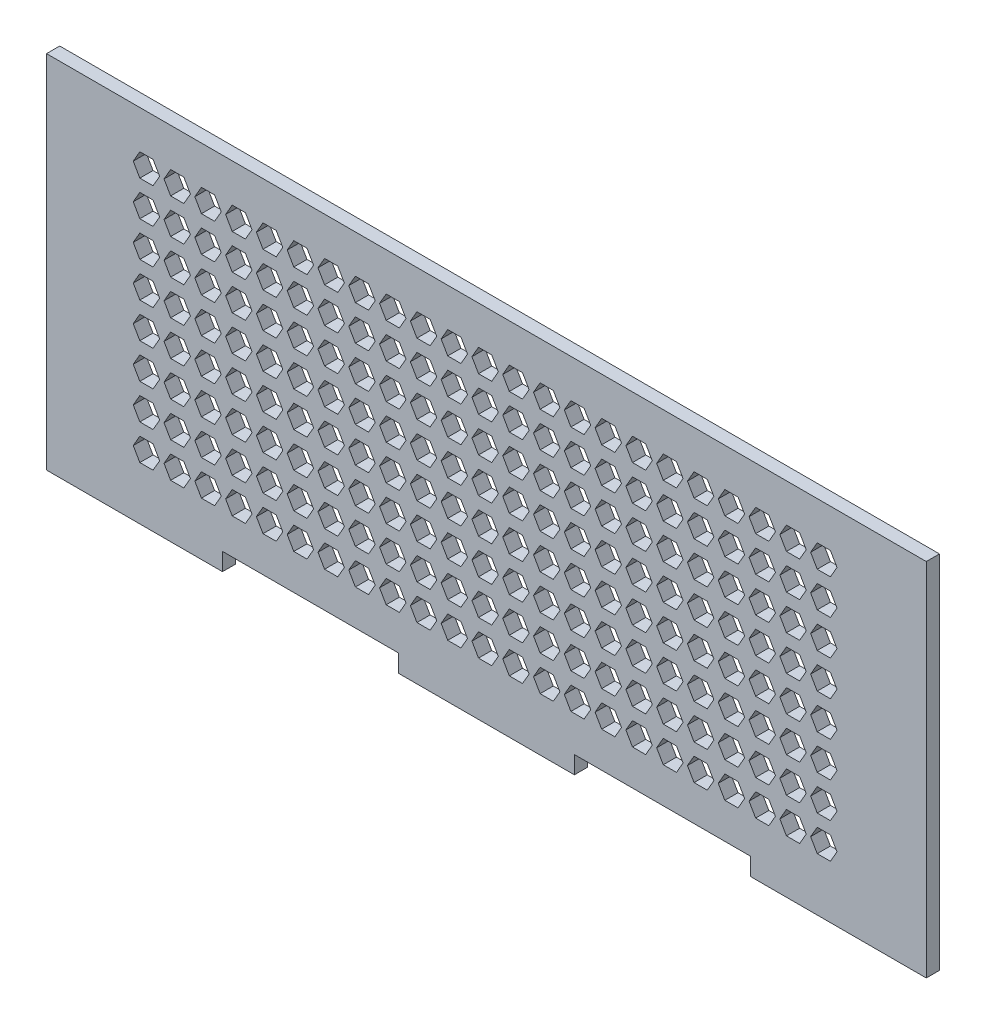
from build123d import *

# Parameters (mm, degrees)
BOSS_EXTRUDE1_DEPTH = 3


with BuildPart() as part:
    # Sketch1 → Boss-Extrude1 (new body)
    with BuildSketch(Plane.XY):
        Polygon((-20, -38), (-20, -42), (20, -42), (20, -38), (60, -38), (60, -42), (100, -42), (100, 40), (-100, 40), (-100, -42), (-60, -42), (-60, -38), align=None)
        Polygon((-78.790355831, -29.911633424), (-80.290355831, -27.313557212), (-78.790355831, -24.715481001), (-75.790355831, -24.715481001), (-74.290355831, -27.313557212), (-75.790355831, -29.911633424), align=None, mode=Mode.SUBTRACT)
        Polygon((-71.790355831, -24.715481001), (-68.790355831, -24.715481001), (-67.290355831, -27.313557212), (-68.790355831, -29.911633424), (-71.790355831, -29.911633424), (-73.290355831, -27.313557212), align=None, mode=Mode.SUBTRACT)
        Polygon((-64.790355831, -24.715481001), (-61.790355831, -24.715481001), (-60.290355831, -27.313557212), (-61.790355831, -29.911633424), (-64.790355831, -29.911633424), (-66.290355831, -27.313557212), align=None, mode=Mode.SUBTRACT)
        Polygon((-57.790355831, -24.715481001), (-54.790355831, -24.715481001), (-53.290355831, -27.313557212), (-54.790355831, -29.911633424), (-57.790355831, -29.911633424), (-59.290355831, -27.313557212), align=None, mode=Mode.SUBTRACT)
        Polygon((-50.790355831, -24.715481001), (-47.790355831, -24.715481001), (-46.290355831, -27.313557212), (-47.790355831, -29.911633424), (-50.790355831, -29.911633424), (-52.290355831, -27.313557212), align=None, mode=Mode.SUBTRACT)
        Polygon((-43.790355831, -24.715481001), (-40.790355831, -24.715481001), (-39.290355831, -27.313557212), (-40.790355831, -29.911633424), (-43.790355831, -29.911633424), (-45.290355831, -27.313557212), align=None, mode=Mode.SUBTRACT)
        Polygon((-36.790355831, -24.715481001), (-33.790355831, -24.715481001), (-32.290355831, -27.313557212), (-33.790355831, -29.911633424), (-36.790355831, -29.911633424), (-38.290355831, -27.313557212), align=None, mode=Mode.SUBTRACT)
        Polygon((-29.790355831, -24.715481001), (-26.790355831, -24.715481001), (-25.290355831, -27.313557212), (-26.790355831, -29.911633424), (-29.790355831, -29.911633424), (-31.290355831, -27.313557212), align=None, mode=Mode.SUBTRACT)
        Polygon((-22.790355831, -24.715481001), (-19.790355831, -24.715481001), (-18.290355831, -27.313557212), (-19.790355831, -29.911633424), (-22.790355831, -29.911633424), (-24.290355831, -27.313557212), align=None, mode=Mode.SUBTRACT)
        Polygon((-15.790355831, -24.715481001), (-12.790355831, -24.715481001), (-11.290355831, -27.313557212), (-12.790355831, -29.911633424), (-15.790355831, -29.911633424), (-17.290355831, -27.313557212), align=None, mode=Mode.SUBTRACT)
        Polygon((-8.790355831, -24.715481001), (-5.790355831, -24.715481001), (-4.290355831, -27.313557212), (-5.790355831, -29.911633424), (-8.790355831, -29.911633424), (-10.290355831, -27.313557212), align=None, mode=Mode.SUBTRACT)
        Polygon((-1.790355831, -24.715481001), (1.209644169, -24.715481001), (2.709644169, -27.313557212), (1.209644169, -29.911633424), (-1.790355831, -29.911633424), (-3.290355831, -27.313557212), align=None, mode=Mode.SUBTRACT)
        Polygon((-78.790355831, -16.715481001), (-75.790355831, -16.715481001), (-74.290355831, -19.313557212), (-75.790355831, -21.911633424), (-78.790355831, -21.911633424), (-80.290355831, -19.313557212), align=None, mode=Mode.SUBTRACT)
        Polygon((-78.790355831, -8.715481001), (-75.790355831, -8.715481001), (-74.290355831, -11.313557212), (-75.790355831, -13.911633424), (-78.790355831, -13.911633424), (-80.290355831, -11.313557212), align=None, mode=Mode.SUBTRACT)
        Polygon((-71.790355831, -16.715481001), (-68.790355831, -16.715481001), (-67.290355831, -19.313557212), (-68.790355831, -21.911633424), (-71.790355831, -21.911633424), (-73.290355831, -19.313557212), align=None, mode=Mode.SUBTRACT)
        Polygon((-64.790355831, -16.715481001), (-61.790355831, -16.715481001), (-60.290355831, -19.313557212), (-61.790355831, -21.911633424), (-64.790355831, -21.911633424), (-66.290355831, -19.313557212), align=None, mode=Mode.SUBTRACT)
        Polygon((-57.790355831, -16.715481001), (-54.790355831, -16.715481001), (-53.290355831, -19.313557212), (-54.790355831, -21.911633424), (-57.790355831, -21.911633424), (-59.290355831, -19.313557212), align=None, mode=Mode.SUBTRACT)
        Polygon((-71.790355831, -8.715481001), (-68.790355831, -8.715481001), (-67.290355831, -11.313557212), (-68.790355831, -13.911633424), (-71.790355831, -13.911633424), (-73.290355831, -11.313557212), align=None, mode=Mode.SUBTRACT)
        Polygon((-64.790355831, -8.715481001), (-61.790355831, -8.715481001), (-60.290355831, -11.313557212), (-61.790355831, -13.911633424), (-64.790355831, -13.911633424), (-66.290355831, -11.313557212), align=None, mode=Mode.SUBTRACT)
        Polygon((-57.790355831, -8.715481001), (-54.790355831, -8.715481001), (-53.290355831, -11.313557212), (-54.790355831, -13.911633424), (-57.790355831, -13.911633424), (-59.290355831, -11.313557212), align=None, mode=Mode.SUBTRACT)
        Polygon((-78.790355831, -0.715481001), (-75.790355831, -0.715481001), (-74.290355831, -3.313557212), (-75.790355831, -5.911633424), (-78.790355831, -5.911633424), (-80.290355831, -3.313557212), align=None, mode=Mode.SUBTRACT)
        Polygon((-71.790355831, -0.715481001), (-68.790355831, -0.715481001), (-67.290355831, -3.313557212), (-68.790355831, -5.911633424), (-71.790355831, -5.911633424), (-73.290355831, -3.313557212), align=None, mode=Mode.SUBTRACT)
        Polygon((-64.790355831, -0.715481001), (-61.790355831, -0.715481001), (-60.290355831, -3.313557212), (-61.790355831, -5.911633424), (-64.790355831, -5.911633424), (-66.290355831, -3.313557212), align=None, mode=Mode.SUBTRACT)
        Polygon((-57.790355831, -0.715481001), (-54.790355831, -0.715481001), (-53.290355831, -3.313557212), (-54.790355831, -5.911633424), (-57.790355831, -5.911633424), (-59.290355831, -3.313557212), align=None, mode=Mode.SUBTRACT)
        Polygon((-50.790355831, -16.715481001), (-47.790355831, -16.715481001), (-46.290355831, -19.313557212), (-47.790355831, -21.911633424), (-50.790355831, -21.911633424), (-52.290355831, -19.313557212), align=None, mode=Mode.SUBTRACT)
        Polygon((-43.790355831, -16.715481001), (-40.790355831, -16.715481001), (-39.290355831, -19.313557212), (-40.790355831, -21.911633424), (-43.790355831, -21.911633424), (-45.290355831, -19.313557212), align=None, mode=Mode.SUBTRACT)
        Polygon((-36.790355831, -16.715481001), (-33.790355831, -16.715481001), (-32.290355831, -19.313557212), (-33.790355831, -21.911633424), (-36.790355831, -21.911633424), (-38.290355831, -19.313557212), align=None, mode=Mode.SUBTRACT)
        Polygon((-29.790355831, -16.715481001), (-26.790355831, -16.715481001), (-25.290355831, -19.313557212), (-26.790355831, -21.911633424), (-29.790355831, -21.911633424), (-31.290355831, -19.313557212), align=None, mode=Mode.SUBTRACT)
        Polygon((-50.790355831, -8.715481001), (-47.790355831, -8.715481001), (-46.290355831, -11.313557212), (-47.790355831, -13.911633424), (-50.790355831, -13.911633424), (-52.290355831, -11.313557212), align=None, mode=Mode.SUBTRACT)
        Polygon((-43.790355831, -8.715481001), (-40.790355831, -8.715481001), (-39.290355831, -11.313557212), (-40.790355831, -13.911633424), (-43.790355831, -13.911633424), (-45.290355831, -11.313557212), align=None, mode=Mode.SUBTRACT)
        Polygon((-36.790355831, -8.715481001), (-33.790355831, -8.715481001), (-32.290355831, -11.313557212), (-33.790355831, -13.911633424), (-36.790355831, -13.911633424), (-38.290355831, -11.313557212), align=None, mode=Mode.SUBTRACT)
        Polygon((-29.790355831, -8.715481001), (-26.790355831, -8.715481001), (-25.290355831, -11.313557212), (-26.790355831, -13.911633424), (-29.790355831, -13.911633424), (-31.290355831, -11.313557212), align=None, mode=Mode.SUBTRACT)
        Polygon((-22.790355831, -16.715481001), (-19.790355831, -16.715481001), (-18.290355831, -19.313557212), (-19.790355831, -21.911633424), (-22.790355831, -21.911633424), (-24.290355831, -19.313557212), align=None, mode=Mode.SUBTRACT)
        Polygon((-15.790355831, -16.715481001), (-12.790355831, -16.715481001), (-11.290355831, -19.313557212), (-12.790355831, -21.911633424), (-15.790355831, -21.911633424), (-17.290355831, -19.313557212), align=None, mode=Mode.SUBTRACT)
        Polygon((-8.790355831, -16.715481001), (-5.790355831, -16.715481001), (-4.290355831, -19.313557212), (-5.790355831, -21.911633424), (-8.790355831, -21.911633424), (-10.290355831, -19.313557212), align=None, mode=Mode.SUBTRACT)
        Polygon((-1.790355831, -16.715481001), (1.209644169, -16.715481001), (2.709644169, -19.313557212), (1.209644169, -21.911633424), (-1.790355831, -21.911633424), (-3.290355831, -19.313557212), align=None, mode=Mode.SUBTRACT)
        Polygon((-22.790355831, -8.715481001), (-19.790355831, -8.715481001), (-18.290355831, -11.313557212), (-19.790355831, -13.911633424), (-22.790355831, -13.911633424), (-24.290355831, -11.313557212), align=None, mode=Mode.SUBTRACT)
        Polygon((-15.790355831, -8.715481001), (-12.790355831, -8.715481001), (-11.290355831, -11.313557212), (-12.790355831, -13.911633424), (-15.790355831, -13.911633424), (-17.290355831, -11.313557212), align=None, mode=Mode.SUBTRACT)
        Polygon((-8.790355831, -8.715481001), (-5.790355831, -8.715481001), (-4.290355831, -11.313557212), (-5.790355831, -13.911633424), (-8.790355831, -13.911633424), (-10.290355831, -11.313557212), align=None, mode=Mode.SUBTRACT)
        Polygon((-1.790355831, -8.715481001), (1.209644169, -8.715481001), (2.709644169, -11.313557212), (1.209644169, -13.911633424), (-1.790355831, -13.911633424), (-3.290355831, -11.313557212), align=None, mode=Mode.SUBTRACT)
        Polygon((-50.790355831, -0.715481001), (-47.790355831, -0.715481001), (-46.290355831, -3.313557212), (-47.790355831, -5.911633424), (-50.790355831, -5.911633424), (-52.290355831, -3.313557212), align=None, mode=Mode.SUBTRACT)
        Polygon((-43.790355831, -0.715481001), (-40.790355831, -0.715481001), (-39.290355831, -3.313557212), (-40.790355831, -5.911633424), (-43.790355831, -5.911633424), (-45.290355831, -3.313557212), align=None, mode=Mode.SUBTRACT)
        Polygon((-36.790355831, -0.715481001), (-33.790355831, -0.715481001), (-32.290355831, -3.313557212), (-33.790355831, -5.911633424), (-36.790355831, -5.911633424), (-38.290355831, -3.313557212), align=None, mode=Mode.SUBTRACT)
        Polygon((-29.790355831, -0.715481001), (-26.790355831, -0.715481001), (-25.290355831, -3.313557212), (-26.790355831, -5.911633424), (-29.790355831, -5.911633424), (-31.290355831, -3.313557212), align=None, mode=Mode.SUBTRACT)
        Polygon((-22.790355831, -0.715481001), (-19.790355831, -0.715481001), (-18.290355831, -3.313557212), (-19.790355831, -5.911633424), (-22.790355831, -5.911633424), (-24.290355831, -3.313557212), align=None, mode=Mode.SUBTRACT)
        Polygon((-15.790355831, -0.715481001), (-12.790355831, -0.715481001), (-11.290355831, -3.313557212), (-12.790355831, -5.911633424), (-15.790355831, -5.911633424), (-17.290355831, -3.313557212), align=None, mode=Mode.SUBTRACT)
        Polygon((-8.790355831, -0.715481001), (-5.790355831, -0.715481001), (-4.290355831, -3.313557212), (-5.790355831, -5.911633424), (-8.790355831, -5.911633424), (-10.290355831, -3.313557212), align=None, mode=Mode.SUBTRACT)
        Polygon((-1.790355831, -0.715481001), (1.209644169, -0.715481001), (2.709644169, -3.313557212), (1.209644169, -5.911633424), (-1.790355831, -5.911633424), (-3.290355831, -3.313557212), align=None, mode=Mode.SUBTRACT)
        Polygon((5.209644169, -24.715481001), (8.209644169, -24.715481001), (9.709644169, -27.313557212), (8.209644169, -29.911633424), (5.209644169, -29.911633424), (3.709644169, -27.313557212), align=None, mode=Mode.SUBTRACT)
        Polygon((12.209644169, -24.715481001), (15.209644169, -24.715481001), (16.709644169, -27.313557212), (15.209644169, -29.911633424), (12.209644169, -29.911633424), (10.709644169, -27.313557212), align=None, mode=Mode.SUBTRACT)
        Polygon((19.209644169, -24.715481001), (22.209644169, -24.715481001), (23.709644169, -27.313557212), (22.209644169, -29.911633424), (19.209644169, -29.911633424), (17.709644169, -27.313557212), align=None, mode=Mode.SUBTRACT)
        Polygon((26.209644169, -24.715481001), (29.209644169, -24.715481001), (30.709644169, -27.313557212), (29.209644169, -29.911633424), (26.209644169, -29.911633424), (24.709644169, -27.313557212), align=None, mode=Mode.SUBTRACT)
        Polygon((33.209644169, -24.715481001), (36.209644169, -24.715481001), (37.709644169, -27.313557212), (36.209644169, -29.911633424), (33.209644169, -29.911633424), (31.709644169, -27.313557212), align=None, mode=Mode.SUBTRACT)
        Polygon((40.209644169, -24.715481001), (43.209644169, -24.715481001), (44.709644169, -27.313557212), (43.209644169, -29.911633424), (40.209644169, -29.911633424), (38.709644169, -27.313557212), align=None, mode=Mode.SUBTRACT)
        Polygon((47.209644169, -24.715481001), (50.209644169, -24.715481001), (51.709644169, -27.313557212), (50.209644169, -29.911633424), (47.209644169, -29.911633424), (45.709644169, -27.313557212), align=None, mode=Mode.SUBTRACT)
        Polygon((54.209644169, -24.715481001), (57.209644169, -24.715481001), (58.709644169, -27.313557212), (57.209644169, -29.911633424), (54.209644169, -29.911633424), (52.709644169, -27.313557212), align=None, mode=Mode.SUBTRACT)
        Polygon((61.209644169, -24.715481001), (64.209644169, -24.715481001), (65.709644169, -27.313557212), (64.209644169, -29.911633424), (61.209644169, -29.911633424), (59.709644169, -27.313557212), align=None, mode=Mode.SUBTRACT)
        Polygon((68.209644169, -24.715481001), (71.209644169, -24.715481001), (72.709644169, -27.313557212), (71.209644169, -29.911633424), (68.209644169, -29.911633424), (66.709644169, -27.313557212), align=None, mode=Mode.SUBTRACT)
        Polygon((75.209644169, -24.715481001), (78.209644169, -24.715481001), (79.709644169, -27.313557212), (78.209644169, -29.911633424), (75.209644169, -29.911633424), (73.709644169, -27.313557212), align=None, mode=Mode.SUBTRACT)
        Polygon((5.209644169, -16.715481001), (8.209644169, -16.715481001), (9.709644169, -19.313557212), (8.209644169, -21.911633424), (5.209644169, -21.911633424), (3.709644169, -19.313557212), align=None, mode=Mode.SUBTRACT)
        Polygon((12.209644169, -16.715481001), (15.209644169, -16.715481001), (16.709644169, -19.313557212), (15.209644169, -21.911633424), (12.209644169, -21.911633424), (10.709644169, -19.313557212), align=None, mode=Mode.SUBTRACT)
        Polygon((19.209644169, -16.715481001), (22.209644169, -16.715481001), (23.709644169, -19.313557212), (22.209644169, -21.911633424), (19.209644169, -21.911633424), (17.709644169, -19.313557212), align=None, mode=Mode.SUBTRACT)
        Polygon((5.209644169, -8.715481001), (8.209644169, -8.715481001), (9.709644169, -11.313557212), (8.209644169, -13.911633424), (5.209644169, -13.911633424), (3.709644169, -11.313557212), align=None, mode=Mode.SUBTRACT)
        Polygon((12.209644169, -8.715481001), (15.209644169, -8.715481001), (16.709644169, -11.313557212), (15.209644169, -13.911633424), (12.209644169, -13.911633424), (10.709644169, -11.313557212), align=None, mode=Mode.SUBTRACT)
        Polygon((19.209644169, -8.715481001), (22.209644169, -8.715481001), (23.709644169, -11.313557212), (22.209644169, -13.911633424), (19.209644169, -13.911633424), (17.709644169, -11.313557212), align=None, mode=Mode.SUBTRACT)
        Polygon((26.209644169, -16.715481001), (29.209644169, -16.715481001), (30.709644169, -19.313557212), (29.209644169, -21.911633424), (26.209644169, -21.911633424), (24.709644169, -19.313557212), align=None, mode=Mode.SUBTRACT)
        Polygon((33.209644169, -16.715481001), (36.209644169, -16.715481001), (37.709644169, -19.313557212), (36.209644169, -21.911633424), (33.209644169, -21.911633424), (31.709644169, -19.313557212), align=None, mode=Mode.SUBTRACT)
        Polygon((40.209644169, -16.715481001), (43.209644169, -16.715481001), (44.709644169, -19.313557212), (43.209644169, -21.911633424), (40.209644169, -21.911633424), (38.709644169, -19.313557212), align=None, mode=Mode.SUBTRACT)
        Polygon((47.209644169, -16.715481001), (50.209644169, -16.715481001), (51.709644169, -19.313557212), (50.209644169, -21.911633424), (47.209644169, -21.911633424), (45.709644169, -19.313557212), align=None, mode=Mode.SUBTRACT)
        Polygon((26.209644169, -8.715481001), (29.209644169, -8.715481001), (30.709644169, -11.313557212), (29.209644169, -13.911633424), (26.209644169, -13.911633424), (24.709644169, -11.313557212), align=None, mode=Mode.SUBTRACT)
        Polygon((33.209644169, -8.715481001), (36.209644169, -8.715481001), (37.709644169, -11.313557212), (36.209644169, -13.911633424), (33.209644169, -13.911633424), (31.709644169, -11.313557212), align=None, mode=Mode.SUBTRACT)
        Polygon((40.209644169, -8.715481001), (43.209644169, -8.715481001), (44.709644169, -11.313557212), (43.209644169, -13.911633424), (40.209644169, -13.911633424), (38.709644169, -11.313557212), align=None, mode=Mode.SUBTRACT)
        Polygon((47.209644169, -8.715481001), (50.209644169, -8.715481001), (51.709644169, -11.313557212), (50.209644169, -13.911633424), (47.209644169, -13.911633424), (45.709644169, -11.313557212), align=None, mode=Mode.SUBTRACT)
        Polygon((5.209644169, -0.715481001), (8.209644169, -0.715481001), (9.709644169, -3.313557212), (8.209644169, -5.911633424), (5.209644169, -5.911633424), (3.709644169, -3.313557212), align=None, mode=Mode.SUBTRACT)
        Polygon((12.209644169, -0.715481001), (15.209644169, -0.715481001), (16.709644169, -3.313557212), (15.209644169, -5.911633424), (12.209644169, -5.911633424), (10.709644169, -3.313557212), align=None, mode=Mode.SUBTRACT)
        Polygon((19.209644169, -0.715481001), (22.209644169, -0.715481001), (23.709644169, -3.313557212), (22.209644169, -5.911633424), (19.209644169, -5.911633424), (17.709644169, -3.313557212), align=None, mode=Mode.SUBTRACT)
        Polygon((26.209644169, -0.715481001), (29.209644169, -0.715481001), (30.709644169, -3.313557212), (29.209644169, -5.911633424), (26.209644169, -5.911633424), (24.709644169, -3.313557212), align=None, mode=Mode.SUBTRACT)
        Polygon((33.209644169, -0.715481001), (36.209644169, -0.715481001), (37.709644169, -3.313557212), (36.209644169, -5.911633424), (33.209644169, -5.911633424), (31.709644169, -3.313557212), align=None, mode=Mode.SUBTRACT)
        Polygon((40.209644169, -0.715481001), (43.209644169, -0.715481001), (44.709644169, -3.313557212), (43.209644169, -5.911633424), (40.209644169, -5.911633424), (38.709644169, -3.313557212), align=None, mode=Mode.SUBTRACT)
        Polygon((47.209644169, -0.715481001), (50.209644169, -0.715481001), (51.709644169, -3.313557212), (50.209644169, -5.911633424), (47.209644169, -5.911633424), (45.709644169, -3.313557212), align=None, mode=Mode.SUBTRACT)
        Polygon((54.209644169, -16.715481001), (57.209644169, -16.715481001), (58.709644169, -19.313557212), (57.209644169, -21.911633424), (54.209644169, -21.911633424), (52.709644169, -19.313557212), align=None, mode=Mode.SUBTRACT)
        Polygon((61.209644169, -16.715481001), (64.209644169, -16.715481001), (65.709644169, -19.313557212), (64.209644169, -21.911633424), (61.209644169, -21.911633424), (59.709644169, -19.313557212), align=None, mode=Mode.SUBTRACT)
        Polygon((68.209644169, -16.715481001), (71.209644169, -16.715481001), (72.709644169, -19.313557212), (71.209644169, -21.911633424), (68.209644169, -21.911633424), (66.709644169, -19.313557212), align=None, mode=Mode.SUBTRACT)
        Polygon((54.209644169, -8.715481001), (57.209644169, -8.715481001), (58.709644169, -11.313557212), (57.209644169, -13.911633424), (54.209644169, -13.911633424), (52.709644169, -11.313557212), align=None, mode=Mode.SUBTRACT)
        Polygon((61.209644169, -8.715481001), (64.209644169, -8.715481001), (65.709644169, -11.313557212), (64.209644169, -13.911633424), (61.209644169, -13.911633424), (59.709644169, -11.313557212), align=None, mode=Mode.SUBTRACT)
        Polygon((68.209644169, -8.715481001), (71.209644169, -8.715481001), (72.709644169, -11.313557212), (71.209644169, -13.911633424), (68.209644169, -13.911633424), (66.709644169, -11.313557212), align=None, mode=Mode.SUBTRACT)
        Polygon((75.209644169, -16.715481001), (78.209644169, -16.715481001), (79.709644169, -19.313557212), (78.209644169, -21.911633424), (75.209644169, -21.911633424), (73.709644169, -19.313557212), align=None, mode=Mode.SUBTRACT)
        Polygon((75.209644169, -8.715481001), (78.209644169, -8.715481001), (79.709644169, -11.313557212), (78.209644169, -13.911633424), (75.209644169, -13.911633424), (73.709644169, -11.313557212), align=None, mode=Mode.SUBTRACT)
        Polygon((54.209644169, -0.715481001), (57.209644169, -0.715481001), (58.709644169, -3.313557212), (57.209644169, -5.911633424), (54.209644169, -5.911633424), (52.709644169, -3.313557212), align=None, mode=Mode.SUBTRACT)
        Polygon((61.209644169, -0.715481001), (64.209644169, -0.715481001), (65.709644169, -3.313557212), (64.209644169, -5.911633424), (61.209644169, -5.911633424), (59.709644169, -3.313557212), align=None, mode=Mode.SUBTRACT)
        Polygon((68.209644169, -0.715481001), (71.209644169, -0.715481001), (72.709644169, -3.313557212), (71.209644169, -5.911633424), (68.209644169, -5.911633424), (66.709644169, -3.313557212), align=None, mode=Mode.SUBTRACT)
        Polygon((75.209644169, -0.715481001), (78.209644169, -0.715481001), (79.709644169, -3.313557212), (78.209644169, -5.911633424), (75.209644169, -5.911633424), (73.709644169, -3.313557212), align=None, mode=Mode.SUBTRACT)
        Polygon((-78.790355831, 7.284518999), (-75.790355831, 7.284518999), (-74.290355831, 4.686442788), (-75.790355831, 2.088366576), (-78.790355831, 2.088366576), (-80.290355831, 4.686442788), align=None, mode=Mode.SUBTRACT)
        Polygon((-71.790355831, 7.284518999), (-68.790355831, 7.284518999), (-67.290355831, 4.686442788), (-68.790355831, 2.088366576), (-71.790355831, 2.088366576), (-73.290355831, 4.686442788), align=None, mode=Mode.SUBTRACT)
        Polygon((-64.790355831, 7.284518999), (-61.790355831, 7.284518999), (-60.290355831, 4.686442788), (-61.790355831, 2.088366576), (-64.790355831, 2.088366576), (-66.290355831, 4.686442788), align=None, mode=Mode.SUBTRACT)
        Polygon((-57.790355831, 7.284518999), (-54.790355831, 7.284518999), (-53.290355831, 4.686442788), (-54.790355831, 2.088366576), (-57.790355831, 2.088366576), (-59.290355831, 4.686442788), align=None, mode=Mode.SUBTRACT)
        Polygon((-78.790355831, 15.284518999), (-75.790355831, 15.284518999), (-74.290355831, 12.686442788), (-75.790355831, 10.088366576), (-78.790355831, 10.088366576), (-80.290355831, 12.686442788), align=None, mode=Mode.SUBTRACT)
        Polygon((-71.790355831, 15.284518999), (-68.790355831, 15.284518999), (-67.290355831, 12.686442788), (-68.790355831, 10.088366576), (-71.790355831, 10.088366576), (-73.290355831, 12.686442788), align=None, mode=Mode.SUBTRACT)
        Polygon((-64.790355831, 15.284518999), (-61.790355831, 15.284518999), (-60.290355831, 12.686442788), (-61.790355831, 10.088366576), (-64.790355831, 10.088366576), (-66.290355831, 12.686442788), align=None, mode=Mode.SUBTRACT)
        Polygon((-57.790355831, 15.284518999), (-54.790355831, 15.284518999), (-53.290355831, 12.686442788), (-54.790355831, 10.088366576), (-57.790355831, 10.088366576), (-59.290355831, 12.686442788), align=None, mode=Mode.SUBTRACT)
        Polygon((-50.790355831, 7.284518999), (-47.790355831, 7.284518999), (-46.290355831, 4.686442788), (-47.790355831, 2.088366576), (-50.790355831, 2.088366576), (-52.290355831, 4.686442788), align=None, mode=Mode.SUBTRACT)
        Polygon((-43.790355831, 7.284518999), (-40.790355831, 7.284518999), (-39.290355831, 4.686442788), (-40.790355831, 2.088366576), (-43.790355831, 2.088366576), (-45.290355831, 4.686442788), align=None, mode=Mode.SUBTRACT)
        Polygon((-36.790355831, 7.284518999), (-33.790355831, 7.284518999), (-32.290355831, 4.686442788), (-33.790355831, 2.088366576), (-36.790355831, 2.088366576), (-38.290355831, 4.686442788), align=None, mode=Mode.SUBTRACT)
        Polygon((-29.790355831, 7.284518999), (-26.790355831, 7.284518999), (-25.290355831, 4.686442788), (-26.790355831, 2.088366576), (-29.790355831, 2.088366576), (-31.290355831, 4.686442788), align=None, mode=Mode.SUBTRACT)
        Polygon((-22.790355831, 7.284518999), (-19.790355831, 7.284518999), (-18.290355831, 4.686442788), (-19.790355831, 2.088366576), (-22.790355831, 2.088366576), (-24.290355831, 4.686442788), align=None, mode=Mode.SUBTRACT)
        Polygon((-15.790355831, 7.284518999), (-12.790355831, 7.284518999), (-11.290355831, 4.686442788), (-12.790355831, 2.088366576), (-15.790355831, 2.088366576), (-17.290355831, 4.686442788), align=None, mode=Mode.SUBTRACT)
        Polygon((-8.790355831, 7.284518999), (-5.790355831, 7.284518999), (-4.290355831, 4.686442788), (-5.790355831, 2.088366576), (-8.790355831, 2.088366576), (-10.290355831, 4.686442788), align=None, mode=Mode.SUBTRACT)
        Polygon((-1.790355831, 7.284518999), (1.209644169, 7.284518999), (2.709644169, 4.686442788), (1.209644169, 2.088366576), (-1.790355831, 2.088366576), (-3.290355831, 4.686442788), align=None, mode=Mode.SUBTRACT)
        Polygon((-50.790355831, 15.284518999), (-47.790355831, 15.284518999), (-46.290355831, 12.686442788), (-47.790355831, 10.088366576), (-50.790355831, 10.088366576), (-52.290355831, 12.686442788), align=None, mode=Mode.SUBTRACT)
        Polygon((-43.790355831, 15.284518999), (-40.790355831, 15.284518999), (-39.290355831, 12.686442788), (-40.790355831, 10.088366576), (-43.790355831, 10.088366576), (-45.290355831, 12.686442788), align=None, mode=Mode.SUBTRACT)
        Polygon((-36.790355831, 15.284518999), (-33.790355831, 15.284518999), (-32.290355831, 12.686442788), (-33.790355831, 10.088366576), (-36.790355831, 10.088366576), (-38.290355831, 12.686442788), align=None, mode=Mode.SUBTRACT)
        Polygon((-29.790355831, 15.284518999), (-26.790355831, 15.284518999), (-25.290355831, 12.686442788), (-26.790355831, 10.088366576), (-29.790355831, 10.088366576), (-31.290355831, 12.686442788), align=None, mode=Mode.SUBTRACT)
        Polygon((-22.790355831, 15.284518999), (-19.790355831, 15.284518999), (-18.290355831, 12.686442788), (-19.790355831, 10.088366576), (-22.790355831, 10.088366576), (-24.290355831, 12.686442788), align=None, mode=Mode.SUBTRACT)
        Polygon((-15.790355831, 15.284518999), (-12.790355831, 15.284518999), (-11.290355831, 12.686442788), (-12.790355831, 10.088366576), (-15.790355831, 10.088366576), (-17.290355831, 12.686442788), align=None, mode=Mode.SUBTRACT)
        Polygon((-8.790355831, 15.284518999), (-5.790355831, 15.284518999), (-4.290355831, 12.686442788), (-5.790355831, 10.088366576), (-8.790355831, 10.088366576), (-10.290355831, 12.686442788), align=None, mode=Mode.SUBTRACT)
        Polygon((-1.790355831, 15.284518999), (1.209644169, 15.284518999), (2.709644169, 12.686442788), (1.209644169, 10.088366576), (-1.790355831, 10.088366576), (-3.290355831, 12.686442788), align=None, mode=Mode.SUBTRACT)
        Polygon((-78.790355831, 23.284518999), (-75.790355831, 23.284518999), (-74.290355831, 20.686442788), (-75.790355831, 18.088366576), (-78.790355831, 18.088366576), (-80.290355831, 20.686442788), align=None, mode=Mode.SUBTRACT)
        Polygon((-78.790355831, 31.284518999), (-75.790355831, 31.284518999), (-74.290355831, 28.686442788), (-75.790355831, 26.088366576), (-78.790355831, 26.088366576), (-80.290355831, 28.686442788), align=None, mode=Mode.SUBTRACT)
        Polygon((-71.790355831, 23.284518999), (-68.790355831, 23.284518999), (-67.290355831, 20.686442788), (-68.790355831, 18.088366576), (-71.790355831, 18.088366576), (-73.290355831, 20.686442788), align=None, mode=Mode.SUBTRACT)
        Polygon((-64.790355831, 23.284518999), (-61.790355831, 23.284518999), (-60.290355831, 20.686442788), (-61.790355831, 18.088366576), (-64.790355831, 18.088366576), (-66.290355831, 20.686442788), align=None, mode=Mode.SUBTRACT)
        Polygon((-57.790355831, 23.284518999), (-54.790355831, 23.284518999), (-53.290355831, 20.686442788), (-54.790355831, 18.088366576), (-57.790355831, 18.088366576), (-59.290355831, 20.686442788), align=None, mode=Mode.SUBTRACT)
        Polygon((-71.790355831, 31.284518999), (-68.790355831, 31.284518999), (-67.290355831, 28.686442788), (-68.790355831, 26.088366576), (-71.790355831, 26.088366576), (-73.290355831, 28.686442788), align=None, mode=Mode.SUBTRACT)
        Polygon((-64.790355831, 31.284518999), (-61.790355831, 31.284518999), (-60.290355831, 28.686442788), (-61.790355831, 26.088366576), (-64.790355831, 26.088366576), (-66.290355831, 28.686442788), align=None, mode=Mode.SUBTRACT)
        Polygon((-57.790355831, 31.284518999), (-54.790355831, 31.284518999), (-53.290355831, 28.686442788), (-54.790355831, 26.088366576), (-57.790355831, 26.088366576), (-59.290355831, 28.686442788), align=None, mode=Mode.SUBTRACT)
        Polygon((-50.790355831, 23.284518999), (-47.790355831, 23.284518999), (-46.290355831, 20.686442788), (-47.790355831, 18.088366576), (-50.790355831, 18.088366576), (-52.290355831, 20.686442788), align=None, mode=Mode.SUBTRACT)
        Polygon((-43.790355831, 23.284518999), (-40.790355831, 23.284518999), (-39.290355831, 20.686442788), (-40.790355831, 18.088366576), (-43.790355831, 18.088366576), (-45.290355831, 20.686442788), align=None, mode=Mode.SUBTRACT)
        Polygon((-36.790355831, 23.284518999), (-33.790355831, 23.284518999), (-32.290355831, 20.686442788), (-33.790355831, 18.088366576), (-36.790355831, 18.088366576), (-38.290355831, 20.686442788), align=None, mode=Mode.SUBTRACT)
        Polygon((-29.790355831, 23.284518999), (-26.790355831, 23.284518999), (-25.290355831, 20.686442788), (-26.790355831, 18.088366576), (-29.790355831, 18.088366576), (-31.290355831, 20.686442788), align=None, mode=Mode.SUBTRACT)
        Polygon((-50.790355831, 31.284518999), (-47.790355831, 31.284518999), (-46.290355831, 28.686442788), (-47.790355831, 26.088366576), (-50.790355831, 26.088366576), (-52.290355831, 28.686442788), align=None, mode=Mode.SUBTRACT)
        Polygon((-43.790355831, 31.284518999), (-40.790355831, 31.284518999), (-39.290355831, 28.686442788), (-40.790355831, 26.088366576), (-43.790355831, 26.088366576), (-45.290355831, 28.686442788), align=None, mode=Mode.SUBTRACT)
        Polygon((-36.790355831, 31.284518999), (-33.790355831, 31.284518999), (-32.290355831, 28.686442788), (-33.790355831, 26.088366576), (-36.790355831, 26.088366576), (-38.290355831, 28.686442788), align=None, mode=Mode.SUBTRACT)
        Polygon((-29.790355831, 31.284518999), (-26.790355831, 31.284518999), (-25.290355831, 28.686442788), (-26.790355831, 26.088366576), (-29.790355831, 26.088366576), (-31.290355831, 28.686442788), align=None, mode=Mode.SUBTRACT)
        Polygon((-22.790355831, 23.284518999), (-19.790355831, 23.284518999), (-18.290355831, 20.686442788), (-19.790355831, 18.088366576), (-22.790355831, 18.088366576), (-24.290355831, 20.686442788), align=None, mode=Mode.SUBTRACT)
        Polygon((-15.790355831, 23.284518999), (-12.790355831, 23.284518999), (-11.290355831, 20.686442788), (-12.790355831, 18.088366576), (-15.790355831, 18.088366576), (-17.290355831, 20.686442788), align=None, mode=Mode.SUBTRACT)
        Polygon((-8.790355831, 23.284518999), (-5.790355831, 23.284518999), (-4.290355831, 20.686442788), (-5.790355831, 18.088366576), (-8.790355831, 18.088366576), (-10.290355831, 20.686442788), align=None, mode=Mode.SUBTRACT)
        Polygon((-1.790355831, 23.284518999), (1.209644169, 23.284518999), (2.709644169, 20.686442788), (1.209644169, 18.088366576), (-1.790355831, 18.088366576), (-3.290355831, 20.686442788), align=None, mode=Mode.SUBTRACT)
        Polygon((-22.790355831, 31.284518999), (-19.790355831, 31.284518999), (-18.290355831, 28.686442788), (-19.790355831, 26.088366576), (-22.790355831, 26.088366576), (-24.290355831, 28.686442788), align=None, mode=Mode.SUBTRACT)
        Polygon((-15.790355831, 31.284518999), (-12.790355831, 31.284518999), (-11.290355831, 28.686442788), (-12.790355831, 26.088366576), (-15.790355831, 26.088366576), (-17.290355831, 28.686442788), align=None, mode=Mode.SUBTRACT)
        Polygon((-8.790355831, 31.284518999), (-5.790355831, 31.284518999), (-4.290355831, 28.686442788), (-5.790355831, 26.088366576), (-8.790355831, 26.088366576), (-10.290355831, 28.686442788), align=None, mode=Mode.SUBTRACT)
        Polygon((-1.790355831, 31.284518999), (1.209644169, 31.284518999), (2.709644169, 28.686442788), (1.209644169, 26.088366576), (-1.790355831, 26.088366576), (-3.290355831, 28.686442788), align=None, mode=Mode.SUBTRACT)
        Polygon((5.209644169, 7.284518999), (8.209644169, 7.284518999), (9.709644169, 4.686442788), (8.209644169, 2.088366576), (5.209644169, 2.088366576), (3.709644169, 4.686442788), align=None, mode=Mode.SUBTRACT)
        Polygon((12.209644169, 7.284518999), (15.209644169, 7.284518999), (16.709644169, 4.686442788), (15.209644169, 2.088366576), (12.209644169, 2.088366576), (10.709644169, 4.686442788), align=None, mode=Mode.SUBTRACT)
        Polygon((19.209644169, 7.284518999), (22.209644169, 7.284518999), (23.709644169, 4.686442788), (22.209644169, 2.088366576), (19.209644169, 2.088366576), (17.709644169, 4.686442788), align=None, mode=Mode.SUBTRACT)
        Polygon((26.209644169, 7.284518999), (29.209644169, 7.284518999), (30.709644169, 4.686442788), (29.209644169, 2.088366576), (26.209644169, 2.088366576), (24.709644169, 4.686442788), align=None, mode=Mode.SUBTRACT)
        Polygon((33.209644169, 7.284518999), (36.209644169, 7.284518999), (37.709644169, 4.686442788), (36.209644169, 2.088366576), (33.209644169, 2.088366576), (31.709644169, 4.686442788), align=None, mode=Mode.SUBTRACT)
        Polygon((40.209644169, 7.284518999), (43.209644169, 7.284518999), (44.709644169, 4.686442788), (43.209644169, 2.088366576), (40.209644169, 2.088366576), (38.709644169, 4.686442788), align=None, mode=Mode.SUBTRACT)
        Polygon((47.209644169, 7.284518999), (50.209644169, 7.284518999), (51.709644169, 4.686442788), (50.209644169, 2.088366576), (47.209644169, 2.088366576), (45.709644169, 4.686442788), align=None, mode=Mode.SUBTRACT)
        Polygon((5.209644169, 15.284518999), (8.209644169, 15.284518999), (9.709644169, 12.686442788), (8.209644169, 10.088366576), (5.209644169, 10.088366576), (3.709644169, 12.686442788), align=None, mode=Mode.SUBTRACT)
        Polygon((12.209644169, 15.284518999), (15.209644169, 15.284518999), (16.709644169, 12.686442788), (15.209644169, 10.088366576), (12.209644169, 10.088366576), (10.709644169, 12.686442788), align=None, mode=Mode.SUBTRACT)
        Polygon((19.209644169, 15.284518999), (22.209644169, 15.284518999), (23.709644169, 12.686442788), (22.209644169, 10.088366576), (19.209644169, 10.088366576), (17.709644169, 12.686442788), align=None, mode=Mode.SUBTRACT)
        Polygon((26.209644169, 15.284518999), (29.209644169, 15.284518999), (30.709644169, 12.686442788), (29.209644169, 10.088366576), (26.209644169, 10.088366576), (24.709644169, 12.686442788), align=None, mode=Mode.SUBTRACT)
        Polygon((33.209644169, 15.284518999), (36.209644169, 15.284518999), (37.709644169, 12.686442788), (36.209644169, 10.088366576), (33.209644169, 10.088366576), (31.709644169, 12.686442788), align=None, mode=Mode.SUBTRACT)
        Polygon((40.209644169, 15.284518999), (43.209644169, 15.284518999), (44.709644169, 12.686442788), (43.209644169, 10.088366576), (40.209644169, 10.088366576), (38.709644169, 12.686442788), align=None, mode=Mode.SUBTRACT)
        Polygon((47.209644169, 15.284518999), (50.209644169, 15.284518999), (51.709644169, 12.686442788), (50.209644169, 10.088366576), (47.209644169, 10.088366576), (45.709644169, 12.686442788), align=None, mode=Mode.SUBTRACT)
        Polygon((54.209644169, 7.284518999), (57.209644169, 7.284518999), (58.709644169, 4.686442788), (57.209644169, 2.088366576), (54.209644169, 2.088366576), (52.709644169, 4.686442788), align=None, mode=Mode.SUBTRACT)
        Polygon((61.209644169, 7.284518999), (64.209644169, 7.284518999), (65.709644169, 4.686442788), (64.209644169, 2.088366576), (61.209644169, 2.088366576), (59.709644169, 4.686442788), align=None, mode=Mode.SUBTRACT)
        Polygon((68.209644169, 7.284518999), (71.209644169, 7.284518999), (72.709644169, 4.686442788), (71.209644169, 2.088366576), (68.209644169, 2.088366576), (66.709644169, 4.686442788), align=None, mode=Mode.SUBTRACT)
        Polygon((75.209644169, 7.284518999), (78.209644169, 7.284518999), (79.709644169, 4.686442788), (78.209644169, 2.088366576), (75.209644169, 2.088366576), (73.709644169, 4.686442788), align=None, mode=Mode.SUBTRACT)
        Polygon((54.209644169, 15.284518999), (57.209644169, 15.284518999), (58.709644169, 12.686442788), (57.209644169, 10.088366576), (54.209644169, 10.088366576), (52.709644169, 12.686442788), align=None, mode=Mode.SUBTRACT)
        Polygon((61.209644169, 15.284518999), (64.209644169, 15.284518999), (65.709644169, 12.686442788), (64.209644169, 10.088366576), (61.209644169, 10.088366576), (59.709644169, 12.686442788), align=None, mode=Mode.SUBTRACT)
        Polygon((68.209644169, 15.284518999), (71.209644169, 15.284518999), (72.709644169, 12.686442788), (71.209644169, 10.088366576), (68.209644169, 10.088366576), (66.709644169, 12.686442788), align=None, mode=Mode.SUBTRACT)
        Polygon((75.209644169, 15.284518999), (78.209644169, 15.284518999), (79.709644169, 12.686442788), (78.209644169, 10.088366576), (75.209644169, 10.088366576), (73.709644169, 12.686442788), align=None, mode=Mode.SUBTRACT)
        Polygon((5.209644169, 23.284518999), (8.209644169, 23.284518999), (9.709644169, 20.686442788), (8.209644169, 18.088366576), (5.209644169, 18.088366576), (3.709644169, 20.686442788), align=None, mode=Mode.SUBTRACT)
        Polygon((12.209644169, 23.284518999), (15.209644169, 23.284518999), (16.709644169, 20.686442788), (15.209644169, 18.088366576), (12.209644169, 18.088366576), (10.709644169, 20.686442788), align=None, mode=Mode.SUBTRACT)
        Polygon((19.209644169, 23.284518999), (22.209644169, 23.284518999), (23.709644169, 20.686442788), (22.209644169, 18.088366576), (19.209644169, 18.088366576), (17.709644169, 20.686442788), align=None, mode=Mode.SUBTRACT)
        Polygon((5.209644169, 31.284518999), (8.209644169, 31.284518999), (9.709644169, 28.686442788), (8.209644169, 26.088366576), (5.209644169, 26.088366576), (3.709644169, 28.686442788), align=None, mode=Mode.SUBTRACT)
        Polygon((12.209644169, 31.284518999), (15.209644169, 31.284518999), (16.709644169, 28.686442788), (15.209644169, 26.088366576), (12.209644169, 26.088366576), (10.709644169, 28.686442788), align=None, mode=Mode.SUBTRACT)
        Polygon((19.209644169, 31.284518999), (22.209644169, 31.284518999), (23.709644169, 28.686442788), (22.209644169, 26.088366576), (19.209644169, 26.088366576), (17.709644169, 28.686442788), align=None, mode=Mode.SUBTRACT)
        Polygon((26.209644169, 23.284518999), (29.209644169, 23.284518999), (30.709644169, 20.686442788), (29.209644169, 18.088366576), (26.209644169, 18.088366576), (24.709644169, 20.686442788), align=None, mode=Mode.SUBTRACT)
        Polygon((33.209644169, 23.284518999), (36.209644169, 23.284518999), (37.709644169, 20.686442788), (36.209644169, 18.088366576), (33.209644169, 18.088366576), (31.709644169, 20.686442788), align=None, mode=Mode.SUBTRACT)
        Polygon((40.209644169, 23.284518999), (43.209644169, 23.284518999), (44.709644169, 20.686442788), (43.209644169, 18.088366576), (40.209644169, 18.088366576), (38.709644169, 20.686442788), align=None, mode=Mode.SUBTRACT)
        Polygon((47.209644169, 23.284518999), (50.209644169, 23.284518999), (51.709644169, 20.686442788), (50.209644169, 18.088366576), (47.209644169, 18.088366576), (45.709644169, 20.686442788), align=None, mode=Mode.SUBTRACT)
        Polygon((26.209644169, 31.284518999), (29.209644169, 31.284518999), (30.709644169, 28.686442788), (29.209644169, 26.088366576), (26.209644169, 26.088366576), (24.709644169, 28.686442788), align=None, mode=Mode.SUBTRACT)
        Polygon((33.209644169, 31.284518999), (36.209644169, 31.284518999), (37.709644169, 28.686442788), (36.209644169, 26.088366576), (33.209644169, 26.088366576), (31.709644169, 28.686442788), align=None, mode=Mode.SUBTRACT)
        Polygon((40.209644169, 31.284518999), (43.209644169, 31.284518999), (44.709644169, 28.686442788), (43.209644169, 26.088366576), (40.209644169, 26.088366576), (38.709644169, 28.686442788), align=None, mode=Mode.SUBTRACT)
        Polygon((47.209644169, 31.284518999), (50.209644169, 31.284518999), (51.709644169, 28.686442788), (50.209644169, 26.088366576), (47.209644169, 26.088366576), (45.709644169, 28.686442788), align=None, mode=Mode.SUBTRACT)
        Polygon((54.209644169, 23.284518999), (57.209644169, 23.284518999), (58.709644169, 20.686442788), (57.209644169, 18.088366576), (54.209644169, 18.088366576), (52.709644169, 20.686442788), align=None, mode=Mode.SUBTRACT)
        Polygon((61.209644169, 23.284518999), (64.209644169, 23.284518999), (65.709644169, 20.686442788), (64.209644169, 18.088366576), (61.209644169, 18.088366576), (59.709644169, 20.686442788), align=None, mode=Mode.SUBTRACT)
        Polygon((68.209644169, 23.284518999), (71.209644169, 23.284518999), (72.709644169, 20.686442788), (71.209644169, 18.088366576), (68.209644169, 18.088366576), (66.709644169, 20.686442788), align=None, mode=Mode.SUBTRACT)
        Polygon((54.209644169, 31.284518999), (57.209644169, 31.284518999), (58.709644169, 28.686442788), (57.209644169, 26.088366576), (54.209644169, 26.088366576), (52.709644169, 28.686442788), align=None, mode=Mode.SUBTRACT)
        Polygon((61.209644169, 31.284518999), (64.209644169, 31.284518999), (65.709644169, 28.686442788), (64.209644169, 26.088366576), (61.209644169, 26.088366576), (59.709644169, 28.686442788), align=None, mode=Mode.SUBTRACT)
        Polygon((68.209644169, 31.284518999), (71.209644169, 31.284518999), (72.709644169, 28.686442788), (71.209644169, 26.088366576), (68.209644169, 26.088366576), (66.709644169, 28.686442788), align=None, mode=Mode.SUBTRACT)
        Polygon((75.209644169, 23.284518999), (78.209644169, 23.284518999), (79.709644169, 20.686442788), (78.209644169, 18.088366576), (75.209644169, 18.088366576), (73.709644169, 20.686442788), align=None, mode=Mode.SUBTRACT)
        Polygon((75.209644169, 31.284518999), (78.209644169, 31.284518999), (79.709644169, 28.686442788), (78.209644169, 26.088366576), (75.209644169, 26.088366576), (73.709644169, 28.686442788), align=None, mode=Mode.SUBTRACT)
    extrude(amount=BOSS_EXTRUDE1_DEPTH)


solid = part.part
